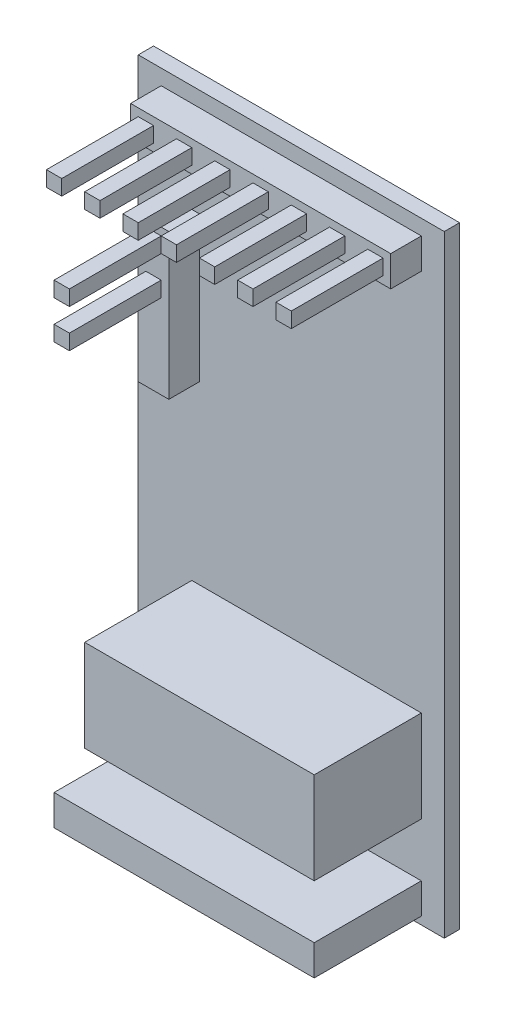
from build123d import *

# Parameters (mm, degrees)
SKETCH2_W              = 17.000000924
SKETCH2_H              = 1.999996603
BOSS_EXTRUDE9_DEPTH    = 2
SKETCH2_H_2            = 2.000004053
BOSS_EXTRUDE9_2_DEPTH  = 2
SKETCH2_W_2            = 2.000000328
SKETCH2_H_3            = 9.4999969
BOSS_EXTRUDE9_3_DEPTH  = 2
SKETCH2_W_3            = 15.000000596
SKETCH2_H_4            = 5.999997258
BOSS_EXTRUDE9_4_DEPTH  = 2
BOSS_EXTRUDE11_DEPTH   = 6
BOSS_EXTRUDE11_2_DEPTH = 6
SKETCH3_W              = 1.000002027
SKETCH3_H              = 1.000002027
BOSS_EXTRUDE11_3_DEPTH = 6
BOSS_EXTRUDE11_4_DEPTH = 6
BOSS_EXTRUDE11_5_DEPTH = 6
BOSS_EXTRUDE11_6_DEPTH = 6
BOSS_EXTRUDE11_7_DEPTH = 6
BOSS_EXTRUDE11_8_DEPTH = 6
BOSS_EXTRUDE11_9_DEPTH = 6
SKETCH1_W              = 20.000003279
SKETCH1_H              = 40.000006557
BOSS_EXTRUDE12_DEPTH   = 1
MOVE_FACE1_BY          = 5
MOVE_FACE1_2_BY        = 5


# Read off the part's stored shape, not the designer's step: Imported1
with BuildPart() as part:
    # Sketch2 → Boss-Extrude9 (new body)
    with BuildSketch(Plane.XY.offset(3.000000957)):
        with Locations((52.782641724, 50.179485232)):
            Rectangle(SKETCH2_W, SKETCH2_H)
    extrude(amount=BOSS_EXTRUDE9_DEPTH)



with BuildPart() as body_2:
    # Sketch2 → Boss-Extrude9 2 (new body)
    with BuildSketch(Plane.XY.offset(3.000000957)):
        with Locations((52.782641724, 86.679488421)):
            Rectangle(SKETCH2_W, SKETCH2_H_2)
    extrude(amount=BOSS_EXTRUDE9_2_DEPTH)


with BuildPart() as body_3:
    # Sketch2 → Boss-Extrude9 3 (new body)
    with BuildSketch(Plane.XY.offset(3.000000957)):
        with Locations((45.782642439, 76.929487288)):
            Rectangle(SKETCH2_W_2, SKETCH2_H_3)
    extrude(amount=BOSS_EXTRUDE9_3_DEPTH)


with BuildPart() as body_4:
    # Sketch2 → Boss-Extrude9 4 (new body)
    with BuildSketch(Plane.XY.offset(3.000000957)):
        with Locations((53.782641888, 57.67948553)):
            Rectangle(SKETCH2_W_3, SKETCH2_H_4)
    extrude(amount=BOSS_EXTRUDE9_4_DEPTH)


with BuildPart() as body_5:
    # Sketch3 → Boss-Extrude11 (new body)
    with BuildSketch(Plane.XY.offset(5.000000957)):
        Polygon((44.782642275, 87.179489434), (45.782644302, 87.179489434), (45.782640576, 86.179487407), (44.782642275, 86.179487407), align=None)
    extrude(amount=BOSS_EXTRUDE11_DEPTH)


with BuildPart() as body_6:
    # Sketch3 → Boss-Extrude11 2 (new body)
    with BuildSketch(Plane.XY.offset(5.000000957)):
        Polygon((47.282643616, 87.179489434), (48.282645643, 87.179489434), (48.282641917, 86.179487407), (47.282643616, 86.179487407), align=None)
    extrude(amount=BOSS_EXTRUDE11_2_DEPTH)


with BuildPart() as body_7:
    # Sketch3 → Boss-Extrude11 3 (new body)
    with BuildSketch(Plane.XY.offset(5.000000957)):
        with Locations((50.282642245, 86.679488421)):
            Rectangle(SKETCH3_W, SKETCH3_H)
    extrude(amount=BOSS_EXTRUDE11_3_DEPTH)


with BuildPart() as body_8:
    # Sketch3 → Boss-Extrude11 4 (new body)
    with BuildSketch(Plane.XY.offset(5.000000957)):
        Polygon((52.282642573, 87.179489434), (53.2826446, 87.179489434), (53.282640874, 86.179487407), (52.282642573, 86.179487407), align=None)
    extrude(amount=BOSS_EXTRUDE11_4_DEPTH)


with BuildPart() as body_9:
    # Sketch3 → Boss-Extrude11 5 (new body)
    with BuildSketch(Plane.XY.offset(5.000000957)):
        Polygon((54.782643914, 87.179489434), (55.782645941, 87.179489434), (55.782642215, 86.179487407), (54.782643914, 86.179487407), align=None)
    extrude(amount=BOSS_EXTRUDE11_5_DEPTH)


with BuildPart() as body_10:
    # Sketch3 → Boss-Extrude11 6 (new body)
    with BuildSketch(Plane.XY.offset(5.000000957)):
        with Locations((57.782642544, 86.679488421)):
            Rectangle(SKETCH3_W, SKETCH3_H)
    extrude(amount=BOSS_EXTRUDE11_6_DEPTH)


with BuildPart() as body_11:
    # Sketch3 → Boss-Extrude11 7 (new body)
    with BuildSketch(Plane.XY.offset(5.000000957)):
        Polygon((59.782642871, 87.179489434), (60.782644898, 87.179489434), (60.782641172, 86.179487407), (59.782642871, 86.179487407), align=None)
    extrude(amount=BOSS_EXTRUDE11_7_DEPTH)


with BuildPart() as body_12:
    # Sketch3 → Boss-Extrude11 8 (new body)
    with BuildSketch(Plane.XY.offset(5.000000957)):
        Polygon((45.282643288, 81.179492176), (46.282645315, 81.179492176), (46.28264159, 80.179490149), (45.282643288, 80.179490149), align=None)
    extrude(amount=BOSS_EXTRUDE11_8_DEPTH)


with BuildPart() as body_13:
    # Sketch3 → Boss-Extrude11 9 (new body)
    with BuildSketch(Plane.XY.offset(5.000000957)):
        Polygon((45.282643288, 78.679487109), (46.282637864, 78.679487109), (46.28264159, 77.679492533), (45.282643288, 77.679492533), align=None)
    extrude(amount=BOSS_EXTRUDE11_9_DEPTH)


with BuildPart() as part_1:
    add(part.part)

    add(body_2.part)  # Boss-Extrude12 merges body 2

    add(body_3.part)  # Boss-Extrude12 merges body 3

    add(body_4.part)  # Boss-Extrude12 merges body 4
    # Sketch1 → Boss-Extrude12 (add)
    with BuildSketch(Plane.XY.offset(3.000000957)):
        with Locations((52.782643587, 68.679489195)):
            Rectangle(SKETCH1_W, SKETCH1_H)
    extrude(amount=-BOSS_EXTRUDE12_DEPTH)

    # Move Face1: a face moved outward by 5.0
    extrude(part_1.faces().sort_by_distance((52.782641724, 50.179485232, 5.000000957))[0], amount=MOVE_FACE1_BY, dir=(0, 0, 1))

    # Move Face1 2: a face moved outward by 5.0
    extrude(part_1.faces().sort_by_distance((53.782641888, 57.67948553, 5.000000957))[0], amount=MOVE_FACE1_2_BY, dir=(0, 0, 1))


solid = Compound([body_5.part, body_6.part, body_7.part, body_8.part, body_9.part, body_10.part, body_11.part, body_12.part, body_13.part, part_1.part])
